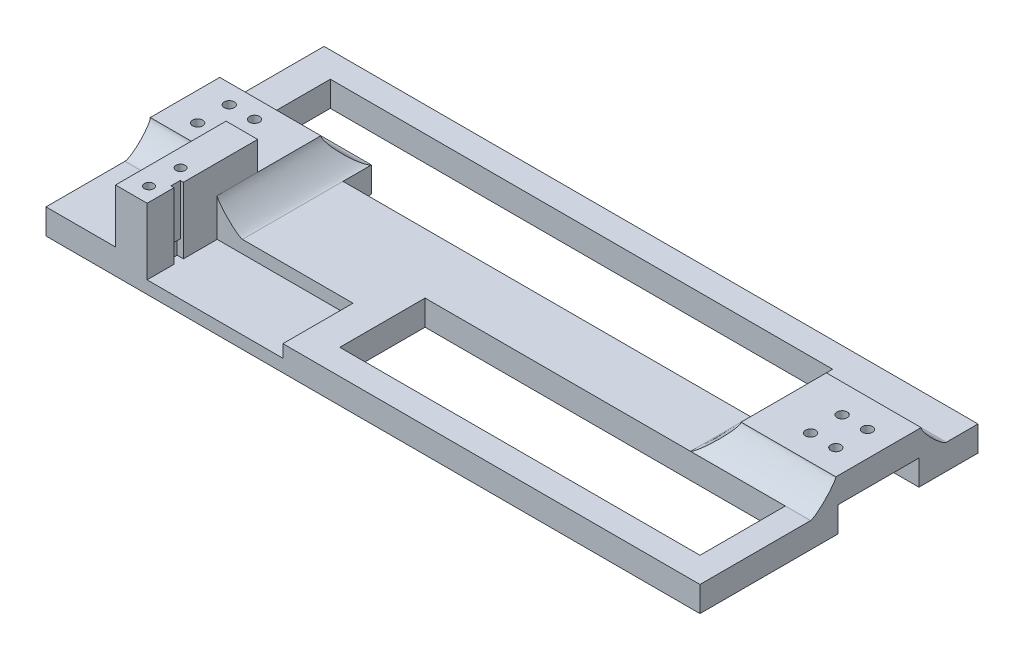
from build123d import *

# Parameters (mm, degrees)
SKETCH1_W            = 300
SKETCH1_H            = 20
BOSS_EXTRUDE1_DEPTH  = 8
SKETCH2_W            = 34
SKETCH2_H            = 8
BOSS_EXTRUDE2_DEPTH  = 9
SKETCH3_W            = 34
SKETCH3_H            = 8
BOSS_EXTRUDE3_DEPTH  = 9
SKETCH4_R            = 1.45
CUT_EXTRUDE1_DEPTH   = 302.504560496
SKETCH5_W            = 25
SKETCH5_H            = 8
BOSS_EXTRUDE4_DEPTH  = 17
SKETCH6_W            = 25
SKETCH6_H            = 8
BOSS_EXTRUDE5_DEPTH  = 17
SKETCH7_W            = 10
SKETCH7_H            = 38
CUT_EXTRUDE2_DEPTH   = 303.37890138
SKETCH8_W            = 7
SKETCH8_H            = 16
CUT_EXTRUDE3_DEPTH   = 4
CUT_EXTRUDE4_DEPTH   = 7
BOSS_EXTRUDE6_DEPTH  = 10
SKETCH12_W           = 8
SKETCH12_H           = 8
BOSS_EXTRUDE7_DEPTH  = 17
SKETCH13_R           = 1.7
CUT_EXTRUDE6_DEPTH   = 305.926220585
SKETCH14_W           = 20
SKETCH14_H           = 13
BOSS_EXTRUDE8_DEPTH  = 12
SKETCH15_R           = 1.6
CUT_EXTRUDE7_DEPTH   = 20
SKETCH16_W           = 20
SKETCH16_H           = 13
BOSS_EXTRUDE9_DEPTH  = 12
SKETCH17_R           = 1.6
CUT_EXTRUDE8_DEPTH   = 20
SKETCH18_W           = 20
SKETCH18_H           = 13
BOSS_EXTRUDE10_DEPTH = 12
CUT_EXTRUDE9_START   = -20
SKETCH19_R           = 1.6
CUT_EXTRUDE9_DEPTH   = 20
SKETCH20_W           = 20
SKETCH20_H           = 13
BOSS_EXTRUDE11_DEPTH = 12
CUT_EXTRUDE10_START  = -20
SKETCH21_R           = 1.6
CUT_EXTRUDE10_DEPTH  = 20
FILLET6_R            = 3
SKETCH22_W           = 114.514593174
SKETCH22_H           = 38.01155773
CUT_EXTRUDE11_DEPTH  = 59
SKETCH23_W           = 255.474860827
SKETCH23_H           = 73.711598505
CUT_EXTRUDE12_DEPTH  = 36
SKETCH24_W           = 30
SKETCH24_H           = 20
BOSS_EXTRUDE12_DEPTH = 8
SKETCH25_W           = 20
SKETCH25_H           = 8
CUT_EXTRUDE13_DEPTH  = 243.357174435
SKETCH26_R           = 1.6
CUT_EXTRUDE14_DEPTH  = 242.960740617
SKETCH27_W           = 30
SKETCH27_H           = 8
BOSS_EXTRUDE13_DEPTH = 15
SKETCH28_W           = 30
SKETCH28_H           = 26
BOSS_EXTRUDE14_DEPTH = 8
SKETCH29_W           = 21
SKETCH29_H           = 8
CUT_EXTRUDE17_DEPTH  = 25
SKETCH30_R           = 1.6
CUT_EXTRUDE18_DEPTH  = 242.960740617
SKETCH31_W           = 10
SKETCH31_H           = 8
BOSS_EXTRUDE15_DEPTH = 34
SKETCH32_W           = 10
SKETCH32_H           = 35
BOSS_EXTRUDE16_DEPTH = 17
SKETCH33_R           = 1.45
CUT_EXTRUDE19_DEPTH  = 249.237789226
SKETCH34_W           = 175
SKETCH34_H           = 34
SKETCH34_W_2         = 155
BOSS_EXTRUDE17_DEPTH = 8
SKETCH35_W           = 19
SKETCH35_H           = 8
BOSS_EXTRUDE23_DEPTH = 8
SKETCH36_W           = 30
SKETCH36_H           = 8
BOSS_EXTRUDE24_DEPTH = 1
SKETCH37_W           = 19
SKETCH37_H           = 8
BOSS_EXTRUDE25_DEPTH = 22
SKETCH38_W           = 30
SKETCH38_H           = 8
BOSS_EXTRUDE26_DEPTH = 1
SKETCH39_W           = 20
SKETCH39_H           = 8
BOSS_EXTRUDE27_DEPTH = 1
SKETCH40_W           = 33.7
SKETCH40_H           = 8
BOSS_EXTRUDE28_DEPTH = 20
SKETCH41_W           = 114.01162948
SKETCH41_H           = 27
SKETCH41_W_2         = 34.98837052
SKETCH41_H_2         = 14.181402085
CUT_EXTRUDE20_DEPTH  = 248.560093715
SKETCH42_W           = 42.98837052
SKETCH42_H           = 22.181402085
BOSS_EXTRUDE29_DEPTH = 4
FILLET13_SIZE        = 8
SKETCH43_W           = 3
SKETCH43_H           = 21
CUT_EXTRUDE21_DEPTH  = 1
SKETCH44_W           = 3
SKETCH44_H           = 5
CUT_EXTRUDE22_DEPTH  = 1
SKETCH45_W           = 21
SKETCH45_H           = 0.3
CUT_EXTRUDE23_DEPTH  = 8
BOSS_EXTRUDE31_DEPTH = 2
FILLET14_START       = 34
FILLET14_DEPTH       = 31.9999999
FILLET14_START_2     = -9.0000001
FILLET14_2_DEPTH     = 8.0000001
FILLET14_START_3     = 65.99999999
FILLET14_3_DEPTH     = 8.00000011


with BuildPart() as part:
    # Sketch1 → Boss-Extrude1 (new body)
    with BuildSketch(Plane(origin=(0, 0, 0), x_dir=(1, 0, 0), z_dir=(0, 1, 0))):
        with Locations((150, -10)):
            Rectangle(SKETCH1_W, SKETCH1_H)
    extrude(amount=BOSS_EXTRUDE1_DEPTH)

    # Sketch2 → Boss-Extrude2 (add)
    with BuildSketch(Plane.XY.offset(20)):
        with Locations((17, 4)):
            Rectangle(SKETCH2_W, SKETCH2_H)
        with Locations((283, 4)):
            Rectangle(SKETCH2_W, SKETCH2_H)
    extrude(amount=BOSS_EXTRUDE2_DEPTH)

    # Sketch3 → Boss-Extrude3 (add)
    with BuildSketch(Plane(origin=(0, 0, 0), x_dir=(-1, 0, 0), z_dir=(0, 0, -1))):
        with Locations((-17, 4)):
            Rectangle(SKETCH3_W, SKETCH3_H)
        with Locations((-283, 4)):
            Rectangle(SKETCH3_W, SKETCH3_H)
    extrude(amount=BOSS_EXTRUDE3_DEPTH)

    # Sketch4 → Cut-Extrude1 (cut, through all)
    with BuildSketch(Plane(origin=(0, 8, 0), x_dir=(1, 0, 0), z_dir=(0, 1, 0))):
        with Locations(Location((4, 5, 0), (0, 0, 270))):
            Circle(SKETCH4_R)
        with Locations(Location((30, 5, 0), (0, 0, 270))):
            Circle(SKETCH4_R)
        with Locations(Location((30, -25, 0), (0, 0, 270))):
            Circle(SKETCH4_R)
        with Locations(Location((4, -25, 0), (0, 0, 270))):
            Circle(SKETCH4_R)
        with Locations(Location((296, -25, 0), (0, 0, 270))):
            Circle(SKETCH4_R)
        with Locations(Location((296, 5, 0), (0, 0, 270))):
            Circle(SKETCH4_R)
        with Locations(Location((270, -25, 0), (0, 0, 270))):
            Circle(SKETCH4_R)
        with Locations(Location((270, 5, 0), (0, 0, 270))):
            Circle(SKETCH4_R)
    extrude(amount=-CUT_EXTRUDE1_DEPTH, mode=Mode.SUBTRACT)

    # Sketch5 → Boss-Extrude4 (add)
    with BuildSketch(Plane.XY.offset(20)):
        with Locations((253.5, 4)):
            Rectangle(SKETCH5_W, SKETCH5_H)
    extrude(amount=BOSS_EXTRUDE4_DEPTH)

    # Sketch6 → Boss-Extrude5 (add)
    with BuildSketch(Plane(origin=(0, 0, 0), x_dir=(-1, 0, 0), z_dir=(0, 0, -1))):
        with Locations((-253.5, 4)):
            Rectangle(SKETCH6_W, SKETCH6_H)
    extrude(amount=BOSS_EXTRUDE5_DEPTH)

    # Sketch7 → Cut-Extrude2 (cut, through all)
    with BuildSketch(Plane(origin=(0, 8, 0), x_dir=(1, 0, 0), z_dir=(0, 1, 0))):
        with Locations((254, -10)):
            Rectangle(SKETCH7_W, SKETCH7_H)
    extrude(amount=-CUT_EXTRUDE2_DEPTH, mode=Mode.SUBTRACT)

    # Sketch8 → Cut-Extrude3 (cut)
    with BuildSketch(Plane(origin=(0, 8, 0), x_dir=(1, 0, 0), z_dir=(0, 1, 0))):
        with Locations((262.5, -10)):
            Rectangle(SKETCH8_W, SKETCH8_H)
    extrude(amount=-CUT_EXTRUDE3_DEPTH, mode=Mode.SUBTRACT)

    # Sketch9 → Cut-Extrude4 (cut)
    with BuildSketch(Plane.ZY.offset(-259)):
        Polygon((18, 4), (22, 8), (18, 8), align=None)
        Polygon((2, 4), (-2, 8), (2, 8), align=None)
    extrude(amount=-CUT_EXTRUDE4_DEPTH, mode=Mode.SUBTRACT)

    # Sketch10 → Boss-Extrude6 (add)
    with BuildSketch(Plane.ZY.offset(-259)):
        Polygon((-2, 0), (-9, 8), (-9, 0), align=None)
        Polygon((29, 8), (22, 0), (29, 0), align=None)
    extrude(amount=BOSS_EXTRUDE6_DEPTH)

    # Sketch12 → Boss-Extrude7 (add)
    with BuildSketch(Plane.XY.offset(37)):
        with Locations((245, 4)):
            Rectangle(SKETCH12_W, SKETCH12_H)
    extrude(amount=BOSS_EXTRUDE7_DEPTH)

    # Sketch13 → Cut-Extrude6 (cut, through all)
    with BuildSketch(Plane(origin=(0, 8, 0), x_dir=(1, 0, 0), z_dir=(0, 1, 0))):
        with Locations(Location((245, -50, 0), (0, 0, 270))):
            Circle(SKETCH13_R)
        with Locations(Location((245, -18, 0), (0, 0, 270))):
            Circle(SKETCH13_R)
    extrude(amount=-CUT_EXTRUDE6_DEPTH, mode=Mode.SUBTRACT)

    # Sketch14 → Boss-Extrude8 (add)
    with BuildSketch(Plane.XY.offset(29)):
        with Locations((285, 6.5)):
            Rectangle(SKETCH14_W, SKETCH14_H)
    extrude(amount=BOSS_EXTRUDE8_DEPTH)

    # Sketch15 → Cut-Extrude7 (cut)
    with BuildSketch(Plane(origin=(295, 0, 0), x_dir=(0, 0, -1), z_dir=(1, 0, 0))):
        with Locations((-35, 8)):
            Circle(SKETCH15_R)
    extrude(amount=-CUT_EXTRUDE7_DEPTH, mode=Mode.SUBTRACT)

    # Sketch16 → Boss-Extrude9 (add)
    with BuildSketch(Plane(origin=(0, 0, -9), x_dir=(-1, 0, 0), z_dir=(0, 0, -1))):
        with Locations((-285, 6.5)):
            Rectangle(SKETCH16_W, SKETCH16_H)
    extrude(amount=BOSS_EXTRUDE9_DEPTH)

    # Sketch17 → Cut-Extrude8 (cut)
    with BuildSketch(Plane(origin=(295, 0, 0), x_dir=(0, 0, -1), z_dir=(1, 0, 0))):
        with Locations((15, 8)):
            Circle(SKETCH17_R)
    extrude(amount=-CUT_EXTRUDE8_DEPTH, mode=Mode.SUBTRACT)

    # Sketch18 → Boss-Extrude10 (add)
    with BuildSketch(Plane(origin=(0, 0, -9), x_dir=(-1, 0, 0), z_dir=(0, 0, -1))):
        with Locations((-15, 6.5)):
            Rectangle(SKETCH18_W, SKETCH18_H)
    extrude(amount=BOSS_EXTRUDE10_DEPTH)

    # Sketch19 → Cut-Extrude9 (cut)
    with BuildSketch(Plane.ZY.offset(-5).offset(CUT_EXTRUDE9_START)):
        with Locations(Location((-15, 8, 0), (0, 0, 180))):
            Circle(SKETCH19_R)
    extrude(amount=CUT_EXTRUDE9_DEPTH, mode=Mode.SUBTRACT)

    # Sketch20 → Boss-Extrude11 (add)
    with BuildSketch(Plane.XY.offset(29)):
        with Locations((15, 6.5)):
            Rectangle(SKETCH20_W, SKETCH20_H)
    extrude(amount=BOSS_EXTRUDE11_DEPTH)

    # Sketch21 → Cut-Extrude10 (cut)
    with BuildSketch(Plane.ZY.offset(-5).offset(CUT_EXTRUDE10_START)):
        with Locations(Location((35, 8, 0), (0, 0, 180))):
            Circle(SKETCH21_R)
    extrude(amount=CUT_EXTRUDE10_DEPTH, mode=Mode.SUBTRACT)

    # Fillet6
    fillet6_edges = [part.edges().sort_by_distance(p)[0] for p in [
        (285, 13, 29),
        (285, 13, 41),
        (285, 13, -9),
        (285, 13, -21),
        (15, 13, -9),
        (15, 13, -21),
        (15, 13, 29),
        (15, 13, 41),
    ]]
    fillet(fillet6_edges, radius=FILLET6_R)

    # Sketch22 → Cut-Extrude11 (cut)
    with BuildSketch(Plane(origin=(300, 0, 0), x_dir=(0, 0, -1), z_dir=(1, 0, 0))):
        with Locations((-15.649926743, 3.068885872)):
            Rectangle(SKETCH22_W, SKETCH22_H)
    extrude(amount=-CUT_EXTRUDE11_DEPTH, mode=Mode.SUBTRACT)

    # Sketch23 → Cut-Extrude12 (cut)
    with BuildSketch(Plane.ZY):
        with Locations((-8.880898517, 0.160078518)):
            Rectangle(SKETCH23_W, SKETCH23_H)
    extrude(amount=-CUT_EXTRUDE12_DEPTH, mode=Mode.SUBTRACT)

    # Sketch24 → Boss-Extrude12 (add)
    with BuildSketch(Plane(origin=(0, 8, 0), x_dir=(1, 0, 0), z_dir=(0, 1, 0))):
        with Locations((51, -10)):
            Rectangle(SKETCH24_W, SKETCH24_H)
    extrude(amount=BOSS_EXTRUDE12_DEPTH)

    # Sketch25 → Cut-Extrude13 (cut, through all)
    with BuildSketch(Plane(origin=(0, 0, 0), x_dir=(-1, 0, 0), z_dir=(0, 0, -1))):
        with Locations((-46, 4)):
            Rectangle(SKETCH25_W, SKETCH25_H)
    extrude(amount=-CUT_EXTRUDE13_DEPTH, mode=Mode.SUBTRACT)

    # Sketch26 → Cut-Extrude14 (cut, through all)
    with BuildSketch(Plane(origin=(0, 8, 0), x_dir=(-1, 0, 0), z_dir=(0, -1, 0))):
        with Locations(Location((-51, -5, 0), (0, 0, 180))):
            Circle(SKETCH26_R)
        with Locations(Location((-51, -15, 0), (0, 0, 180))):
            Circle(SKETCH26_R)
        with Locations(Location((-43, -5, 0), (0, 0, 180))):
            Circle(SKETCH26_R)
        with Locations(Location((-43, -15, 0), (0, 0, 180))):
            Circle(SKETCH26_R)
    extrude(amount=-CUT_EXTRUDE14_DEPTH, mode=Mode.SUBTRACT)

    # Sketch27 → Boss-Extrude13 (add)
    with BuildSketch(Plane(origin=(0, 0, 0), x_dir=(-1, 0, 0), z_dir=(0, 0, -1))):
        with Locations((-226, 4)):
            Rectangle(SKETCH27_W, SKETCH27_H)
    extrude(amount=BOSS_EXTRUDE13_DEPTH)

    # Sketch28 → Boss-Extrude14 (add)
    with BuildSketch(Plane(origin=(0, 8, 0), x_dir=(1, 0, 0), z_dir=(0, 1, 0))):
        with Locations((226, 2)):
            Rectangle(SKETCH28_W, SKETCH28_H)
    extrude(amount=BOSS_EXTRUDE14_DEPTH)

    # Sketch29 → Cut-Extrude17 (cut)
    with BuildSketch(Plane(origin=(0, 0, -15), x_dir=(-1, 0, 0), z_dir=(0, 0, -1))):
        with Locations((-230.5, 4)):
            Rectangle(SKETCH29_W, SKETCH29_H)
    extrude(amount=-CUT_EXTRUDE17_DEPTH, mode=Mode.SUBTRACT)

    # Sketch30 → Cut-Extrude18 (cut, through all)
    with BuildSketch(Plane(origin=(0, 8, 0), x_dir=(-1, 0, 0), z_dir=(0, -1, 0))):
        with Locations(Location((-225, 7, 0), (0, 0, 90))):
            Circle(SKETCH30_R)
        with Locations(Location((-225, -3, 0), (0, 0, 90))):
            Circle(SKETCH30_R)
        with Locations(Location((-233, 7, 0), (0, 0, 90))):
            Circle(SKETCH30_R)
        with Locations(Location((-233, -3, 0), (0, 0, 90))):
            Circle(SKETCH30_R)
    extrude(amount=-CUT_EXTRUDE18_DEPTH, mode=Mode.SUBTRACT)

    # Sketch31 → Boss-Extrude15 (add)
    with BuildSketch(Plane.XY.offset(20)):
        with Locations((61, 4)):
            Rectangle(SKETCH31_W, SKETCH31_H)
    extrude(amount=BOSS_EXTRUDE15_DEPTH)

    # Sketch32 → Boss-Extrude16 (add)
    with BuildSketch(Plane(origin=(0, 8, 0), x_dir=(1, 0, 0), z_dir=(0, 1, 0))):
        with Locations((61, -36.5)):
            Rectangle(SKETCH32_W, SKETCH32_H)
    extrude(amount=BOSS_EXTRUDE16_DEPTH)

    # Sketch33 → Cut-Extrude19 (cut, through all)
    with BuildSketch(Plane(origin=(0, 25, 0), x_dir=(1, 0, 0), z_dir=(0, 1, 0))):
        with Locations(Location((61.6, -39, 0), (0, 0, 270))):
            Circle(SKETCH33_R)
        with Locations(Location((61.6, -49, 0), (0, 0, 270))):
            Circle(SKETCH33_R)
    extrude(amount=-CUT_EXTRUDE19_DEPTH, mode=Mode.SUBTRACT)

    # Sketch34 → Boss-Extrude17 (add)
    with BuildSketch(Plane(origin=(0, 0, 0), x_dir=(-1, 0, 0), z_dir=(0, -1, 0))):
        with Locations((-153.5, -37)):
            Rectangle(SKETCH34_W, SKETCH34_H)
        with Locations((-133.5, 17)):
            Rectangle(SKETCH34_W_2, SKETCH34_H)
    extrude(amount=-BOSS_EXTRUDE17_DEPTH)

    # Sketch35 → Boss-Extrude23 (add)
    with BuildSketch(Plane(origin=(211, 0, 0), x_dir=(0, 0, -1), z_dir=(1, 0, 0))):
        with Locations((24.5, 4)):
            Rectangle(SKETCH35_W, SKETCH35_H)
    extrude(amount=BOSS_EXTRUDE23_DEPTH)

    # Sketch36 → Boss-Extrude24 (add)
    with BuildSketch(Plane(origin=(0, 0, -15), x_dir=(-1, 0, 0), z_dir=(0, 0, -1))):
        with Locations((-226, 12)):
            Rectangle(SKETCH36_W, SKETCH36_H)
    extrude(amount=BOSS_EXTRUDE24_DEPTH)

    # Sketch37 → Boss-Extrude25 (add)
    with BuildSketch(Plane(origin=(219, 0, 0), x_dir=(0, 0, -1), z_dir=(1, 0, 0))):
        with Locations((24.5, 4)):
            Rectangle(SKETCH37_W, SKETCH37_H)
    extrude(amount=BOSS_EXTRUDE25_DEPTH)

    # Sketch38 → Boss-Extrude26 (add)
    with BuildSketch(Plane(origin=(0, 0, 0), x_dir=(-1, 0, 0), z_dir=(0, 0, -1))):
        with Locations((-51, 12)):
            Rectangle(SKETCH38_W, SKETCH38_H)
    extrude(amount=BOSS_EXTRUDE26_DEPTH)

    # Sketch39 → Boss-Extrude27 (add)
    with BuildSketch(Plane.XY.offset(20)):
        with Locations((46, 12)):
            Rectangle(SKETCH39_W, SKETCH39_H)
    extrude(amount=BOSS_EXTRUDE27_DEPTH)

    # Sketch40 → Boss-Extrude28 (add)
    with BuildSketch(Plane.ZY.offset(-56)):
        with Locations((-17.15, 4)):
            Rectangle(SKETCH40_W, SKETCH40_H)
        with Locations((37.15, 4)):
            Rectangle(SKETCH40_W, SKETCH40_H)
    extrude(amount=BOSS_EXTRUDE28_DEPTH)

    # Sketch41 → Cut-Extrude20 (cut, through all)
    with BuildSketch(Plane(origin=(0, 8, 0), x_dir=(1, 0, 0), z_dir=(0, 1, 0))):
        with Locations((175.99418526, -32.5)):
            Rectangle(SKETCH41_W, SKETCH41_H)
        Polygon((44, 9), (74, 9), (74, 0), (203, 0), (203, 26), (44, 26), align=None)
        with Locations((91.49418526, -38.909298957)):
            Rectangle(SKETCH41_W_2, SKETCH41_H_2)
        Polygon((108.98837052, -54), (108.98837052, -46), (74, -46), (74, -31.818597915), (66, -31.818597915), (66, -54), align=None)
    extrude(amount=-CUT_EXTRUDE20_DEPTH, mode=Mode.SUBTRACT)

    # Sketch42 → Boss-Extrude29 (add)
    with BuildSketch(Plane(origin=(0, 0, 0), x_dir=(-1, 0, 0), z_dir=(0, -1, 0))):
        with Locations((-87.49418526, -42.909298957)):
            Rectangle(SKETCH42_W, SKETCH42_H)
    extrude(amount=-BOSS_EXTRUDE29_DEPTH)

    # Fillet13
    # a fillet whose section is not a circle: 8 mm, written as the material it adds along each edge
    with BuildSketch(Plane(origin=(66, 8, -1), x_dir=(1, 0, 0), z_dir=(0, 0, 1))) as fillet13_piece_1:
        with BuildLine():
            Bezier((FILLET13_SIZE, 0), (0, 0), (0, FILLET13_SIZE), weights=[1, 0.176470588, 1])
            Line((0, FILLET13_SIZE), (0, 0))
            Line((0, 0), (FILLET13_SIZE, 0))
        make_face()
    extrude(amount=32.818597915)
    with BuildSketch(Plane(origin=(211, 8, -16), x_dir=(0, 0, -1), z_dir=(1, 0, 0))) as fillet13_piece_2:
        with BuildLine():
            Bezier((FILLET13_SIZE, 0), (0, 0), (0, FILLET13_SIZE), weights=[1, 0.176470588, 1])
            Line((0, FILLET13_SIZE), (0, 0))
            Line((0, 0), (FILLET13_SIZE, 0))
        make_face()
    extrude(amount=30)
    with BuildSketch(Plane(origin=(211, 8, 11), x_dir=(0, 0, 1), z_dir=(1, 0, 0))) as fillet13_piece_3:
        with BuildLine():
            Bezier((FILLET13_SIZE, 0), (0, 0), (0, -FILLET13_SIZE), weights=[1, 0.176470588, 1])
            Line((0, -FILLET13_SIZE), (0, 0))
            Line((0, 0), (FILLET13_SIZE, 0))
        make_face()
    extrude(amount=30)
    with BuildSketch(Plane(origin=(211, 8, 11), x_dir=(-1, 0, 0), z_dir=(0, 0, -1))) as fillet13_piece_4:
        with BuildLine():
            Bezier((FILLET13_SIZE, 0), (0, 0), (0, FILLET13_SIZE), weights=[1, 0.176470588, 1])
            Line((0, FILLET13_SIZE), (0, 0))
            Line((0, 0), (FILLET13_SIZE, 0))
        make_face()
    extrude(amount=27)
    with BuildSketch(Plane(origin=(211, 8, 11), x_dir=(-1, 0, 0), z_dir=(0, 0, -1))) as fillet13_piece_5a_section:
        with BuildLine():
            Bezier((FILLET13_SIZE, 0), (0, 0), (0, FILLET13_SIZE), weights=[1, 0.176470588, 1])
            Line((0, FILLET13_SIZE), (0, 0))
            Line((0, 0), (FILLET13_SIZE, 0))
        make_face()
    fillet13_piece_5a = extrude(amount=47, mode=Mode.PRIVATE)
    fillet13_piece_5a = split(fillet13_piece_5a, bisect_by=Plane(origin=(211, 8, -26), z_dir=(0, 0, 1)), keep=Keep.TOP, mode=Mode.PRIVATE)
    fillet13_piece_5a = split(fillet13_piece_5a, bisect_by=Plane(origin=(211, 8, -16), z_dir=(0, 0, -1)), keep=Keep.TOP, mode=Mode.PRIVATE)
    with BuildSketch(Plane(origin=(191, 8, -16), x_dir=(0, 0, -1), z_dir=(1, 0, 0))) as fillet13_piece_5b_section:
        with BuildLine():
            Bezier((FILLET13_SIZE, 0), (0, 0), (0, FILLET13_SIZE), weights=[1, 0.176470588, 1])
            Line((0, FILLET13_SIZE), (0, 0))
            Line((0, 0), (FILLET13_SIZE, 0))
        make_face()
    fillet13_piece_5b = extrude(amount=50, mode=Mode.PRIVATE)
    fillet13_piece_5b = split(fillet13_piece_5b, bisect_by=Plane(origin=(203, 8, -16), z_dir=(1, 0, 0)), keep=Keep.TOP, mode=Mode.PRIVATE)
    fillet13_piece_5b = split(fillet13_piece_5b, bisect_by=Plane(origin=(211, 8, -16), z_dir=(-1, 0, 0)), keep=Keep.TOP, mode=Mode.PRIVATE)
    fillet13_piece_5 = fillet13_piece_5a & fillet13_piece_5b
    add(fillet13_piece_5)
    with BuildSketch(Plane(origin=(191, 8, 11), x_dir=(0, 0, 1), z_dir=(1, 0, 0))) as fillet13_piece_6a_section:
        with BuildLine():
            Bezier((FILLET13_SIZE, 0), (0, 0), (0, -FILLET13_SIZE), weights=[1, 0.176470588, 1])
            Line((0, -FILLET13_SIZE), (0, 0))
            Line((0, 0), (FILLET13_SIZE, 0))
        make_face()
    fillet13_piece_6a = extrude(amount=50, mode=Mode.PRIVATE)
    fillet13_piece_6a = split(fillet13_piece_6a, bisect_by=Plane(origin=(211, 8, 11), z_dir=(-1, 0, 0)), keep=Keep.TOP, mode=Mode.PRIVATE)
    with BuildSketch(Plane(origin=(211, 8, 31), x_dir=(-1, 0, 0), z_dir=(0, 0, -1))) as fillet13_piece_6b_section:
        with BuildLine():
            Bezier((FILLET13_SIZE, 0), (0, 0), (0, FILLET13_SIZE), weights=[1, 0.176470588, 1])
            Line((0, FILLET13_SIZE), (0, 0))
            Line((0, 0), (FILLET13_SIZE, 0))
        make_face()
    fillet13_piece_6b = extrude(amount=47, mode=Mode.PRIVATE)
    fillet13_piece_6b = split(fillet13_piece_6b, bisect_by=Plane(origin=(211, 8, 19), z_dir=(0, 0, -1)), keep=Keep.TOP, mode=Mode.PRIVATE)
    fillet13_piece_6b = split(fillet13_piece_6b, bisect_by=Plane(origin=(211, 8, 11), z_dir=(0, 0, 1)), keep=Keep.TOP, mode=Mode.PRIVATE)
    fillet13_piece_6 = fillet13_piece_6a & fillet13_piece_6b
    add(fillet13_piece_6)

    # Sketch43 → Cut-Extrude21 (cut)
    with BuildSketch(Plane(origin=(66, 0, 0), x_dir=(0, 0, -1), z_dir=(1, 0, 0))):
        with Locations((-44, 14.5)):
            Rectangle(SKETCH43_W, SKETCH43_H)
    extrude(amount=-CUT_EXTRUDE21_DEPTH, mode=Mode.SUBTRACT)

    # Sketch44 → Cut-Extrude22 (cut)
    with BuildSketch(Plane(origin=(65, 0, 0), x_dir=(0, 0, -1), z_dir=(1, 0, 0))):
        with Locations((-44, 6.5)):
            Rectangle(SKETCH44_W, SKETCH44_H)
    extrude(amount=-CUT_EXTRUDE22_DEPTH, mode=Mode.SUBTRACT)

    # Sketch45 → Cut-Extrude23 (cut)
    with BuildSketch(Plane(origin=(0, 0, 0), x_dir=(-1, 0, 0), z_dir=(0, -1, 0))):
        with Locations((-230.5, 15.15)):
            Rectangle(SKETCH45_W, SKETCH45_H)
        with Locations((-230.5, -10.15)):
            Rectangle(SKETCH45_W, SKETCH45_H)
    extrude(amount=-CUT_EXTRUDE23_DEPTH, mode=Mode.SUBTRACT)

    # Sketch47 → Boss-Extrude31 (add)
    with BuildSketch(Plane.ZY.offset(-36)):
        Polygon((20.3, 8), (20.3, 0), (54, 0), (54, 8), (21, 8), (21, 16), (-1, 16), (-1, 8), (-34, 8), (-34, 0), (-0.3, 0), (-0.3, 8), align=None)
    extrude(amount=BOSS_EXTRUDE31_DEPTH)

    # Fillet14: read off the stored shape, not the designer's step
    # Fillet14 outline → Fillet14 (add)
    with BuildSketch(Plane.YZ.offset(FILLET14_START)):
        with BuildLine():
            add(Edge.make_bspline(
                [(8, 29), (8, 21), (16, 21)],
                knots=[0, 0, 0, 1, 1, 1], degree=2, weights=[1, 0.25, 1]))
            Line((8, 29), (8, 21))
            Line((8, 21), (16, 21))
        make_face()
        with BuildLine():
            Line((8, -1), (8, -9))
            add(Edge.make_bspline(
                [(8, -9), (8, -1), (16, -1)],
                knots=[0, 0, 0, 1, 1, 1], degree=2, weights=[1, 0.25, 1]))
            Line((16, -1), (8, -1))
        make_face()
    extrude(amount=FILLET14_DEPTH)

    # Fillet14 2 outline → Fillet14 2 (add)
    with BuildSketch(Plane.XY.offset(FILLET14_START_2)):
        with BuildLine():
            add(Edge.make_bspline(
                [(66, 16), (66, 8), (74, 8)],
                knots=[0, 0, 0, 1, 1, 1], degree=2, weights=[1, 0.176470588, 1]))
            Line((66, 16), (65.9999999, 8))
            Line((65.9999999, 8), (74, 8))
        make_face()
    extrude(amount=FILLET14_2_DEPTH)

    # Fillet14 3 outline → Fillet14 3 (cut)
    with BuildSketch(Plane.YZ.offset(FILLET14_START_3)):
        with BuildLine():
            add(Edge.make_bspline(
                [(8, -9), (8, -1), (16, -1)],
                knots=[0, 0, 0, 1, 1, 1], degree=2, weights=[1, 0.25, 1]))
            Line((8, -9), (16, -9.0000001))
            Line((16, -9.0000001), (16, -1))
        make_face()
    extrude(amount=FILLET14_3_DEPTH, mode=Mode.SUBTRACT)


solid = part.part
